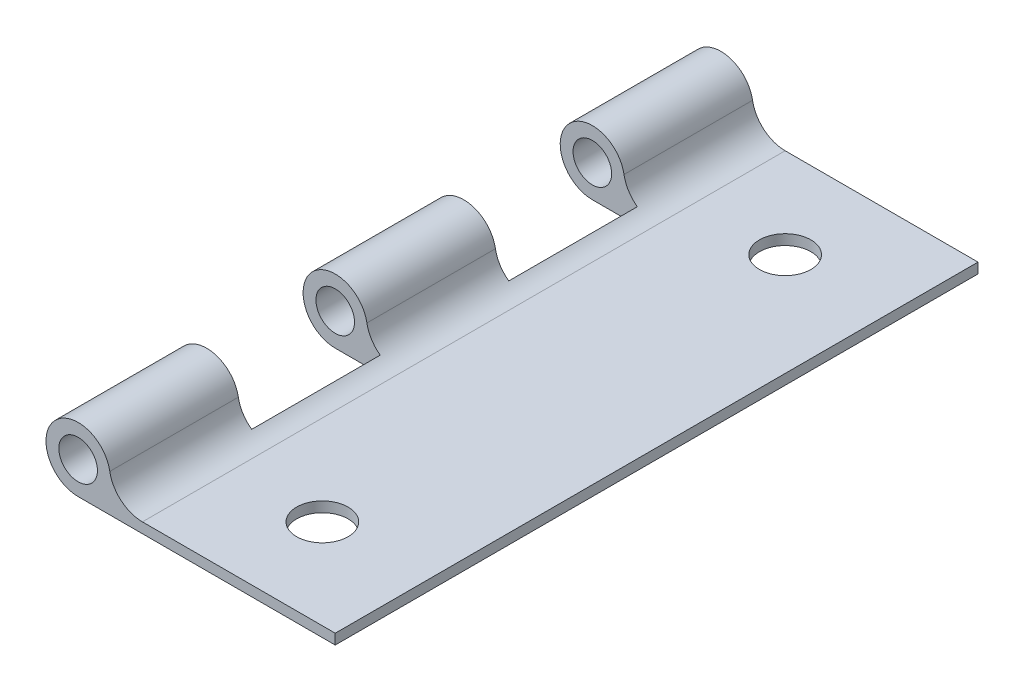
from build123d import *

# Parameters (mm, degrees)
ESBO_O1_R                = 1.5
RESSALTO_EXTRUS_O1_DEPTH = 50
ESBO_O2_R                = 2
ESBO_O2_W                = 6
ESBO_O2_H                = 10
CORTE_EXTRUS_O1_DEPTH    = 56.056788864


with BuildPart() as part:
    # Esboço1 → Ressalto-extrusão1 (new body)
    with BuildSketch(Plane.XY):
        with BuildLine():
            Line((0, 0), (-20, 0))
            ThreePointArc((-20, 0), (-22.499911314, 2.521057642), (-19.95788621, 4.999645261))
            ThreePointArc((-19.95788621, 4.999645261), (-18.375952887, 4.400650146), (-17.537523452, 2.9315197))
            ThreePointArc((-17.537523452, 2.9315197), (-16.656985327, 1.403588896), (-15, 0.8))
            Line((-15, 0.8), (0, 0.8))
            Line((0, 0.8), (0, 0))
        make_face()
        with Locations((-20, 2.5)):
            Circle(ESBO_O1_R, mode=Mode.SUBTRACT)
    extrude(amount=RESSALTO_EXTRUS_O1_DEPTH)

    # Esboço2 → Corte-extrusão1 (cut, through all)
    with BuildSketch(Plane.XZ):
        with Locations((-8, 43)):
            Circle(ESBO_O2_R)
        with Locations((-8, 7)):
            Circle(ESBO_O2_R)
        with Locations((-19.5, 15)):
            Rectangle(ESBO_O2_W, ESBO_O2_H)
        with Locations((-19.5, 35)):
            Rectangle(ESBO_O2_W, ESBO_O2_H)
    extrude(amount=-CORTE_EXTRUS_O1_DEPTH, mode=Mode.SUBTRACT)


solid = part.part
